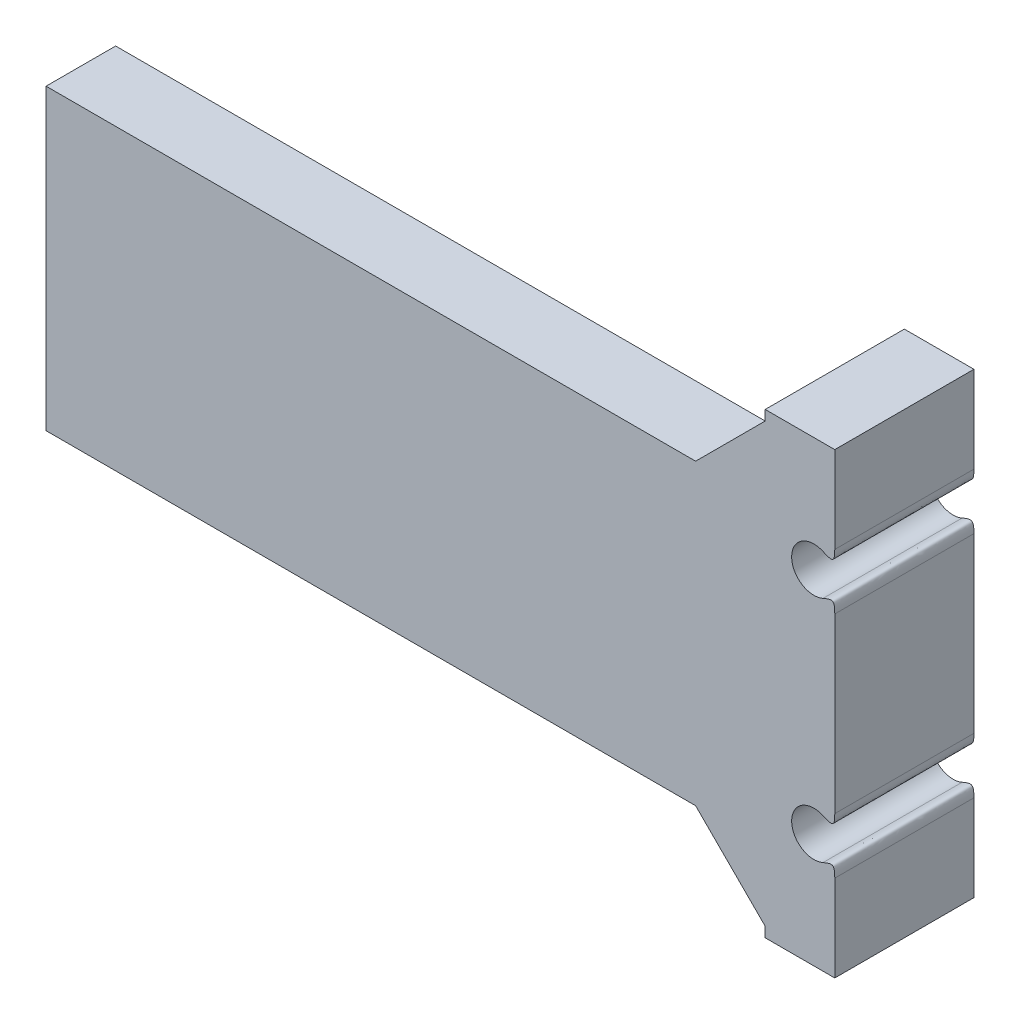
from build123d import *

# Parameters (mm, degrees)
SALIENTE_EXTRUIR1_DEPTH = 10
CHAFL_N1_SIZE           = 5
CORTAR_EXTRUIR1_DEPTH   = 38


with BuildPart() as part:
    # Croquis1 → Saliente-Extruir1 (new body)
    with BuildSketch(Plane.XY):
        with BuildLine():
            Line((-5, -7.284781413), (-10, -7.284781413))
            Line((-10, -7.284781413), (-10, -1.56358606))
            Line((-10, -1.56358606), (-61.678046138, -1.56358606))
            Line((-61.678046138, -1.56358606), (-61.678046138, 19.878804647))
            Line((-61.678046138, 19.878804647), (-10, 19.878804647))
            Line((-10, 19.878804647), (-10, 25.6))
            Line((-10, 25.6), (-5, 25.6))
            Line((-5, 25.6), (-5, 17.935581083))
            ThreePointArc((-5, 17.935581083), (-8.1, 17.378804647), (-5, 16.82202821))
            Line((-5, 16.82202821), (-5, 1.493190376))
            ThreePointArc((-5, 1.493190376), (-8.1, 0.93641394), (-5, 0.379637504))
            Line((-5, 0.379637504), (-5, -7.284781413))
        make_face()
    extrude(amount=-SALIENTE_EXTRUIR1_DEPTH)

    # Chaflán1
    chafl_n1_edges = [part.edges().sort_by_distance(p)[0] for p in [
        (-10, -1.56358606, -5),
        (-10, 19.878804647, -5),
    ]]
    chamfer(chafl_n1_edges, length=CHAFL_N1_SIZE)

    # Croquis2 → Cortar-Extruir1 (cut)
    with BuildSketch(Plane(origin=(-7.102128625, -7.284781413, 0), x_dir=(0, 0, -1), z_dir=(0, 1, 0))):
        Polygon((5, 7.897871375), (5, 54.575917513), (10, 54.575917513), (10, 2.897871375), align=None)
    extrude(amount=CORTAR_EXTRUIR1_DEPTH, mode=Mode.SUBTRACT)

    # Redondeo1
    # a fillet whose section is not a circle: 0.6 mm, written as the material it takes off along each edge
    with BuildSketch(Plane(origin=(-5, 17.935581083, 3.626773884), x_dir=(-0.6833782327560586, 0.730064511529773, 0), z_dir=(0, 0, -1)), Plane(origin=(-5, 1.493190376, 3.626773884), x_dir=(-0.6833782327560585, 0.7300645115297733, 0), z_dir=(0, 0, -1))) as redondeo1_piece_1:
        with BuildLine():
            Bezier((1.237169264, 0), (0.382683433, 0.358211533), (1.059111562, 0.991383331), weights=[1, 1.857142857, 1])
            Line((1.059111562, 0.991383331), (0, 0))
            ThreePointArc((0, 0), (0.618584632, 0.124414336), (1.237169264, 0))
        make_face()
    extrude(amount=17.253547769, mode=Mode.SUBTRACT)
    with BuildSketch(Plane(origin=(-5, 16.82202821, 3.626773884), x_dir=(0, -1, 0), z_dir=(0, 0, -1)), Plane(origin=(-5, 0.379637504, 3.626773884), x_dir=(0, -1, 0), z_dir=(0, 0, -1))) as redondeo1_piece_2:
        with BuildLine():
            Bezier((1.450709554, 0), (0.524177558, 0), (0.903213375, 0.845454545), weights=[1, 1.857142857, 1])
            ThreePointArc((0.903213375, 0.845454545), (0.536628736, 0.331896782), (0, 0))
            Line((0, 0), (1.450709554, 0))
        make_face()
    extrude(amount=17.253547769, mode=Mode.SUBTRACT)


solid = part.part
